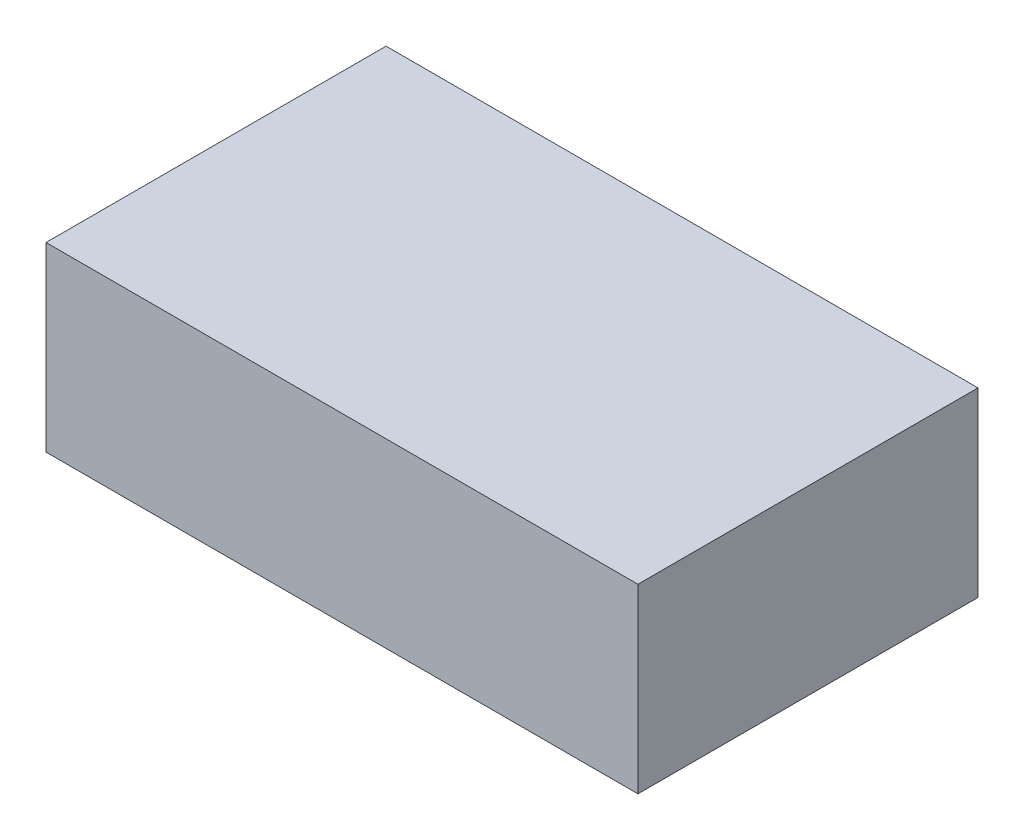
from build123d import *

# Parameters (mm, degrees)
SKETCH1_W           = 46.3
SKETCH1_H           = 26.6
BOSS_EXTRUDE1_DEPTH = 14.2


with BuildPart() as part:
    # Sketch1 → Boss-Extrude1 (new body)
    with BuildSketch(Plane(origin=(0, 0, 0), x_dir=(1, 0, 0), z_dir=(0, 1, 0))):
        with Locations((23.15, 13.3)):
            Rectangle(SKETCH1_W, SKETCH1_H)
    extrude(amount=BOSS_EXTRUDE1_DEPTH)


solid = part.part
